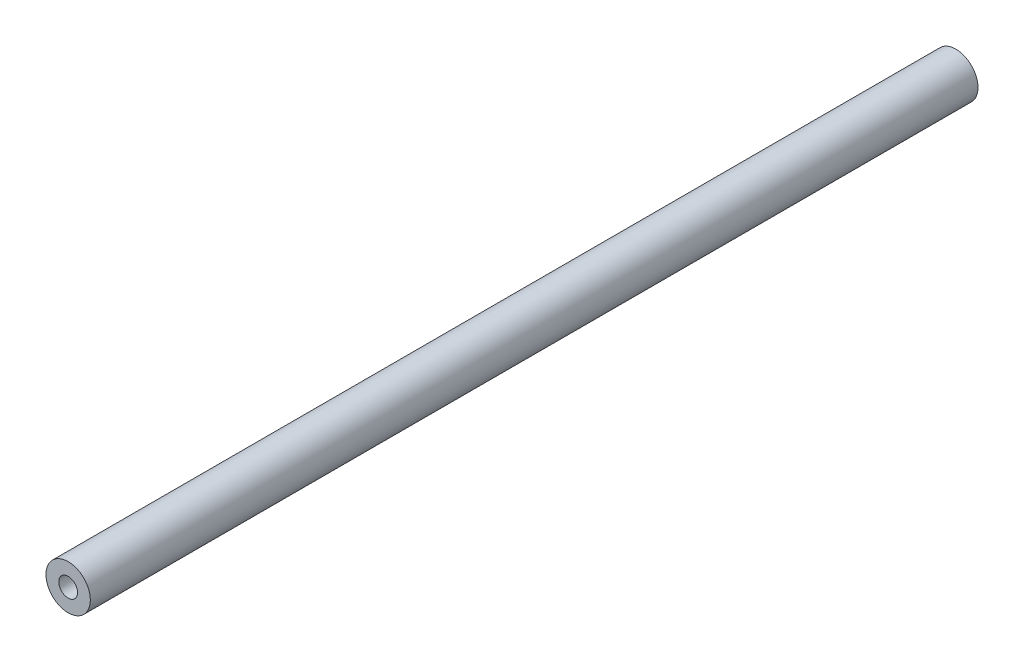
from build123d import *

# Parameters (mm, degrees)
SKETCH1_R                  = 4.7625
BOSS_EXTRUDE1_DEPTH        = 190.5
F_10_32_TAPPED_HOLE1_D     = 4.0386
F_10_32_TAPPED_HOLE1_DEPTH = 19.05
F_10_32_TAPPED_HOLE1_TIP   = 1.213317848
F_10_32_TAPPED_HOLE4_D     = 4.0386
F_10_32_TAPPED_HOLE4_DEPTH = 19.05
F_10_32_TAPPED_HOLE4_TIP   = 1.213317848


with BuildPart() as part:
    # Sketch1 → Boss-Extrude1 (new body)
    with BuildSketch(Plane.XY):
        Circle(SKETCH1_R)
    extrude(amount=-BOSS_EXTRUDE1_DEPTH)

    # #10-32 Tapped Hole1
    with Locations(Plane(origin=(0, 0, -190.5), x_dir=(-1, 0, 0), z_dir=(0, 0, -1))):
        with Locations((0, 0)):
            Hole(F_10_32_TAPPED_HOLE1_D / 2, depth=F_10_32_TAPPED_HOLE1_DEPTH)
            with Locations((0, 0, -(F_10_32_TAPPED_HOLE1_DEPTH + F_10_32_TAPPED_HOLE1_TIP / 2))):  # 118° drill point
                Cone(0, F_10_32_TAPPED_HOLE1_D / 2, F_10_32_TAPPED_HOLE1_TIP, mode=Mode.SUBTRACT)

    # #10-32 Tapped Hole4
    with Locations(Plane.XY):
        with Locations((0, 0)):
            Hole(F_10_32_TAPPED_HOLE4_D / 2, depth=F_10_32_TAPPED_HOLE4_DEPTH)
            with Locations((0, 0, -(F_10_32_TAPPED_HOLE4_DEPTH + F_10_32_TAPPED_HOLE4_TIP / 2))):  # 118° drill point
                Cone(0, F_10_32_TAPPED_HOLE4_D / 2, F_10_32_TAPPED_HOLE4_TIP, mode=Mode.SUBTRACT)


solid = part.part
